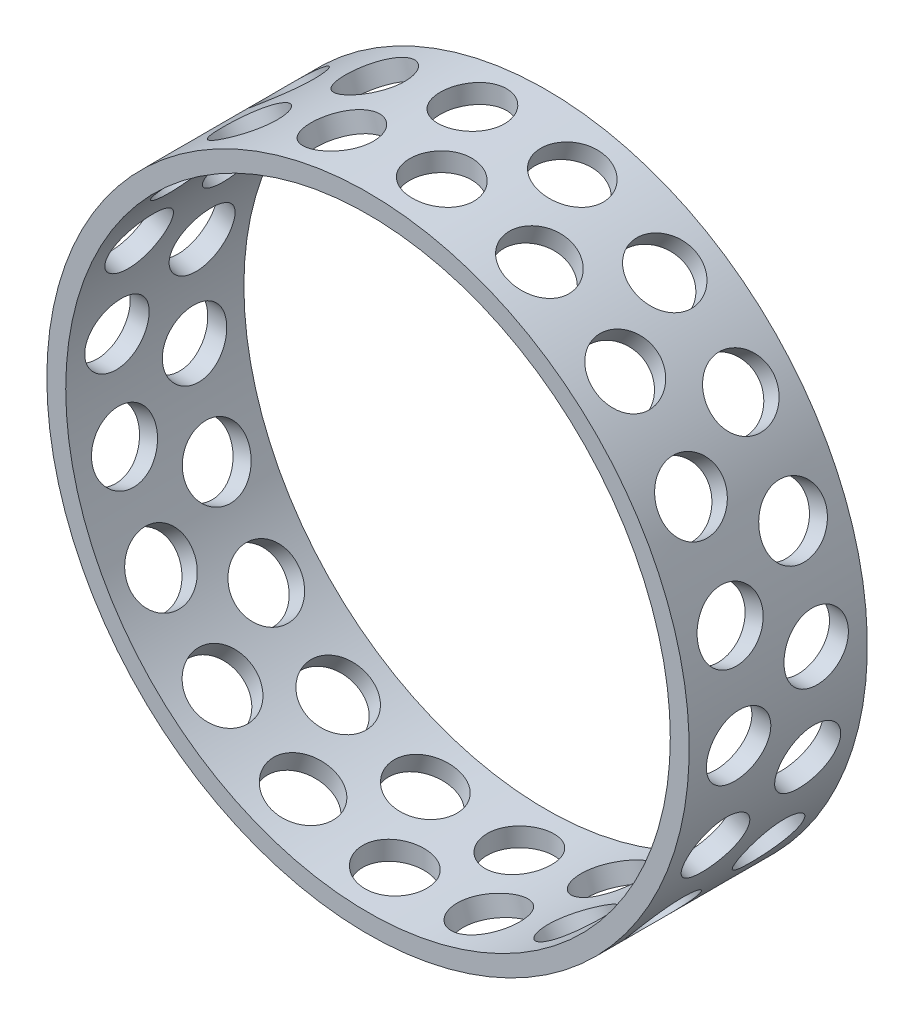
from build123d import *

# Parameters (mm, degrees)
SKETCH1_W          = 47.15
SKETCH1_H          = 5
SKETCH2_R          = 8.5
CUT_EXTRUDE1_DEPTH = 130.492720645
CIRPATTERN1_COUNT  = 20


with BuildPart() as part:
    # Sketch1 → Revolve1 (revolve)
    with BuildSketch(Plane(origin=(0, 0, 0), x_dir=(0, 0, -1), z_dir=(1, 0, 0))):
        with Locations((24.575, 82.49983)):
            Rectangle(SKETCH1_W, SKETCH1_H)
    revolve(axis=Axis((0, 0, -50.5075), (0, 0, 1)))

    # Sketch2 → Cut-Extrude1 (cut, through all)
    with BuildSketch(Plane(origin=(0, 0, 0), x_dir=(0, 0, -1), z_dir=(1, 0, 0))):
        with Locations((14.309765987, 6.214899086)):
            Circle(SKETCH2_R)
        with Locations((34.840234013, -6.214899086)):
            Circle(SKETCH2_R)
    cut_extrude1 = extrude(amount=-CUT_EXTRUDE1_DEPTH, mode=Mode.SUBTRACT)

    # CirPattern1: Cut-Extrude1 ×20 about axis
    cirpattern1_axis = Axis((0, 0, -50.5075), (0, 0, 1))
    for i in range(1, CIRPATTERN1_COUNT):
        add(cut_extrude1.rotate(cirpattern1_axis, i * 360 / CIRPATTERN1_COUNT), mode=Mode.SUBTRACT)


solid = part.part
